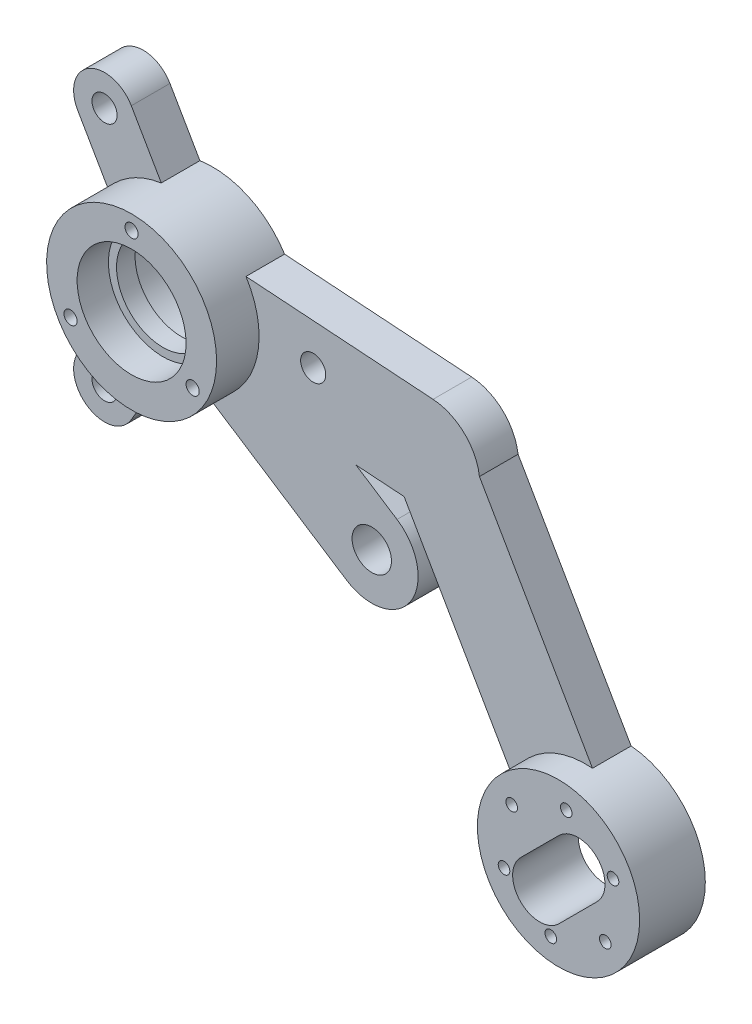
from build123d import *

# Parameters (mm, degrees)
S01_BEARING_BARREL_R                           = 22
F_01_BEARING_BARREL_DEPTH                      = 21
F_02_TORQUE_ARM_1_DEPTH                        = 10
F_03_TORQUE_ARM_2_DEPTH                        = 10
F_04_TORQUE_ARM_3_DEPTH                        = 10
F_05_WHEEL_ARM_ROOT_TO_ROUNDED_ELBOW_DEPTH     = 10
F_06_LONG_DROPPED_WHEEL_ARM_DEPTH              = 10
F_07_BROAD_CAM_FOLLOWER_MOUNTING_LUG_DEPTH     = 10
F_08_START                                     = -1
S08_BEARING_THROUGH_RELIEF_R                   = 12
F_08_BEARING_THROUGH_RELIEF_DEPTH              = 23
F_09_START                                     = -0.1
S09_INBOARD_6001_SEAT_R                        = 14.1
F_09_INBOARD_6001_SEAT_DEPTH                   = 8.2
F_10_START                                     = 12.9
S10_OUTBOARD_6001_SEAT_R                       = 14.1
F_10_OUTBOARD_6001_SEAT_DEPTH                  = 8.2
F_11_START                                     = -1
S11_KEEPER_SCREWS_R                            = 1.7
F_11_KEEPER_SCREWS_DEPTH                       = 23
F_12_START                                     = -1
S12_TORQUE_PIN_RETAINING_STEMS_R               = 3.25
F_12_TORQUE_PIN_RETAINING_STEMS_DEPTH          = 12
S13_WHEEL_TIP_THROUGH_BOLT_LAND_R              = 21
F_13_WHEEL_TIP_THROUGH_BOLT_LAND_DEPTH         = 10
F_14_START                                     = 10
S14_INBOARD_6808_INNER_RACE_SHOULDER_R         = 21
F_14_INBOARD_6808_INNER_RACE_SHOULDER_DEPTH    = 7
F_19_START                                     = -1
S19_THROUGH_BORE_FOR_STEEL_FOLLOWER_BU_R       = 5.1
F_19_THROUGH_BORE_FOR_STEEL_FOLLOWER_BUS_DEPTH = 12
F_20_START                                     = -0.1
S20_FLUSH_SEAT_FOR_BUSH_FLANGE_R               = 7.6
F_20_FLUSH_SEAT_FOR_BUSH_FLANGE_DEPTH          = 2.1
SKETCH2_R                                      = 1.5
CUT_EXTRUDE1_DEPTH                             = 161.708734997
CUT_EXTRUDE2_DEPTH                             = 161.235131929


with BuildPart() as part:
    # S01 - Bearing barrel → 01 - Bearing barrel (new body)
    with BuildSketch(Plane.XY):
        Circle(S01_BEARING_BARREL_R)
    extrude(amount=F_01_BEARING_BARREL_DEPTH)

    # S02 - Torque arm 1 → 02 - Torque arm 1 (add)
    with BuildSketch(Plane.XY):
        with BuildLine():
            Line((0, 8), (36, 8))
            ThreePointArc((36, 8), (44, 0), (36, -8))
            Line((36, -8), (0, -8))
            ThreePointArc((0, -8), (-8, 0), (0, 8))
        make_face()
    extrude(amount=F_02_TORQUE_ARM_1_DEPTH)

    # S03 - Torque arm 2 → 03 - Torque arm 2 (add)
    with BuildSketch(Plane.XY):
        with BuildLine():
            Line((-6.92820323, -4), (-24.92820323, 27.176914536))
            ThreePointArc((-24.92820323, 27.176914536), (-22, 38.105117767), (-11.07179677, 35.176914536))
            Line((-11.07179677, 35.176914536), (6.92820323, 4))
            ThreePointArc((6.92820323, 4), (4, -6.92820323), (-6.92820323, -4))
        make_face()
    extrude(amount=F_03_TORQUE_ARM_2_DEPTH)

    # S04 - Torque arm 3 → 04 - Torque arm 3 (add)
    with BuildSketch(Plane.XY):
        with BuildLine():
            Line((6.92820323, -4), (-11.07179677, -35.176914536))
            ThreePointArc((-11.07179677, -35.176914536), (-22, -38.105117767), (-24.92820323, -27.176914536))
            Line((-24.92820323, -27.176914536), (-6.92820323, 4))
            ThreePointArc((-6.92820323, 4), (4, 6.92820323), (6.92820323, -4))
        make_face()
    extrude(amount=F_04_TORQUE_ARM_3_DEPTH)

    # S05 - Wheel arm root to rounded elbow → 05 - Wheel arm root to rounded elbow (add)
    with BuildSketch(Plane.XY):
        with BuildLine():
            Line((0.890943823, 12.969434032), (67.022341031, 8.426494092))
            ThreePointArc((67.022341031, 8.426494092), (79.10083124, -5.433883763), (65.240453385, -17.512373972))
            Line((65.240453385, -17.512373972), (-0.890943823, -12.969434032))
            ThreePointArc((-0.890943823, -12.969434032), (-12.969434032, 0.890943823), (0.890943823, 12.969434032))
        make_face()
    extrude(amount=F_05_WHEEL_ARM_ROOT_TO_ROUNDED_ELBOW_DEPTH)

    # S06 - Long dropped wheel arm → 06 - Long dropped wheel arm (add)
    with BuildSketch(Plane.XY):
        with BuildLine():
            Line((76.528125799, 1.449391376), (116.886494349, -68.572605409))
            ThreePointArc((116.886494349, -68.572605409), (112.482097074, -84.961665317), (96.093037167, -80.557268042))
            Line((96.093037167, -80.557268042), (55.734668617, -10.535271257))
            ThreePointArc((55.734668617, -10.535271257), (60.139065892, 5.853788651), (76.528125799, 1.449391376))
        make_face()
    extrude(amount=F_06_LONG_DROPPED_WHEEL_ARM_DEPTH)

    # S07 - Broad cam follower mounting lug → 07 - Broad cam follower mounting lug (add)
    with BuildSketch(Plane.XY):
        with BuildLine():
            Line((6.53566842, 10.064046815), (57.694573065, -23.158934321))
            ThreePointArc((57.694573065, -23.158934321), (61.22295146, -39.758649556), (44.623236224, -43.287027951))
            Line((44.623236224, -43.287027951), (-6.53566842, -10.064046815))
            ThreePointArc((-6.53566842, -10.064046815), (-10.064046815, 6.53566842), (6.53566842, 10.064046815))
        make_face()
    extrude(amount=F_07_BROAD_CAM_FOLLOWER_MOUNTING_LUG_DEPTH)

    # S08 - Bearing through relief → 08 - Bearing through relief (cut)
    with BuildSketch(Plane.XY.offset(F_08_START)):
        Circle(S08_BEARING_THROUGH_RELIEF_R)
    extrude(amount=F_08_BEARING_THROUGH_RELIEF_DEPTH, mode=Mode.SUBTRACT)

    # S09 - Inboard 6001 seat → 09 - Inboard 6001 seat (cut)
    with BuildSketch(Plane.XY.offset(F_09_START)):
        Circle(S09_INBOARD_6001_SEAT_R)
    extrude(amount=F_09_INBOARD_6001_SEAT_DEPTH, mode=Mode.SUBTRACT)

    # S10 - Outboard 6001 seat → 10 - Outboard 6001 seat (cut)
    with BuildSketch(Plane.XY.offset(F_10_START)):
        Circle(S10_OUTBOARD_6001_SEAT_R)
    extrude(amount=F_10_OUTBOARD_6001_SEAT_DEPTH, mode=Mode.SUBTRACT)

    # S11 - Keeper screws → 11 - Keeper screws (cut)
    with BuildSketch(Plane.XY.offset(F_11_START)):
        with Locations((0, 18.25)):
            Circle(S11_KEEPER_SCREWS_R)
        with Locations((-15.804963619, -9.125)):
            Circle(S11_KEEPER_SCREWS_R)
        with Locations((15.804963619, -9.125)):
            Circle(S11_KEEPER_SCREWS_R)
    extrude(amount=F_11_KEEPER_SCREWS_DEPTH, mode=Mode.SUBTRACT)

    # S12 - Torque pin retaining stems → 12 - Torque pin retaining stems (cut)
    with BuildSketch(Plane.XY.offset(F_12_START)):
        with Locations((36, 0)):
            Circle(S12_TORQUE_PIN_RETAINING_STEMS_R)
        with Locations((-18, 31.176914536)):
            Circle(S12_TORQUE_PIN_RETAINING_STEMS_R)
        with Locations((-18, -31.176914536)):
            Circle(S12_TORQUE_PIN_RETAINING_STEMS_R)
    extrude(amount=F_12_TORQUE_PIN_RETAINING_STEMS_DEPTH, mode=Mode.SUBTRACT)

    # S13 - Wheel tip through-bolt land → 13 - Wheel tip through-bolt land (add)
    with BuildSketch(Plane.XY):
        with Locations((106.489765758, -74.564936726)):
            Circle(S13_WHEEL_TIP_THROUGH_BOLT_LAND_R)
    extrude(amount=F_13_WHEEL_TIP_THROUGH_BOLT_LAND_DEPTH)

    # S14 - Inboard 6808 inner-race shoulder → 14 - Inboard 6808 inner-race shoulder (add)
    with BuildSketch(Plane.XY.offset(F_14_START)):
        with Locations((106.489765758, -74.564936726)):
            Circle(S14_INBOARD_6808_INNER_RACE_SHOULDER_R)
    extrude(amount=F_14_INBOARD_6808_INNER_RACE_SHOULDER_DEPTH)

    # S19 - Through bore for steel follower bush → 19 - Through bore for steel follower bush (cut)
    with BuildSketch(Plane.XY.offset(F_19_START)):
        with Locations((51.158904645, -33.222981136)):
            Circle(S19_THROUGH_BORE_FOR_STEEL_FOLLOWER_BU_R)
    extrude(amount=F_19_THROUGH_BORE_FOR_STEEL_FOLLOWER_BUS_DEPTH, mode=Mode.SUBTRACT)

    # S20 - Flush seat for bush flange → 20 - Flush seat for bush flange (cut)
    with BuildSketch(Plane.XY.offset(F_20_START)):
        with Locations((51.158904645, -33.222981136)):
            Circle(S20_FLUSH_SEAT_FOR_BUSH_FLANGE_R)
    extrude(amount=F_20_FLUSH_SEAT_FOR_BUSH_FLANGE_DEPTH, mode=Mode.SUBTRACT)

    # Sketch2 → Cut-Extrude1 (cut, through all)
    with BuildSketch(Plane(origin=(0, 0, 0), x_dir=(-1, 0, 0), z_dir=(0, 0, -1))):
        with Locations((-104.49361525, -89.698859157)):
            Circle(SKETCH2_R)
        with Locations((-92.38532922, -80.403180892)):
            Circle(SKETCH2_R)
        with Locations((-118.598051788, -83.860614991)):
            Circle(SKETCH2_R)
        with Locations((-120.594202296, -68.726692559)):
            Circle(SKETCH2_R)
        with Locations((-108.485916265, -59.431014295)):
            Circle(SKETCH2_R)
        with Locations((-94.381479727, -65.269258461)):
            Circle(SKETCH2_R)
    extrude(amount=-CUT_EXTRUDE1_DEPTH, mode=Mode.SUBTRACT)

    # Sketch7 → Cut-Extrude2 (cut, through all)
    with BuildSketch(Plane.XY.offset(17)):
        with BuildLine():
            Line((96.668388671, -75.960835392), (106.567883608, -66.061340455))
            ThreePointArc((106.567883608, -66.061340455), (116.467378544, -66.061340455), (116.467378544, -75.960835392))
            Line((116.467378544, -75.960835392), (106.567883608, -85.860330328))
            ThreePointArc((106.567883608, -85.860330328), (96.668388671, -85.860330328), (96.668388671, -75.960835392))
        make_face()
    extrude(amount=-CUT_EXTRUDE2_DEPTH, mode=Mode.SUBTRACT)


solid = part.part
